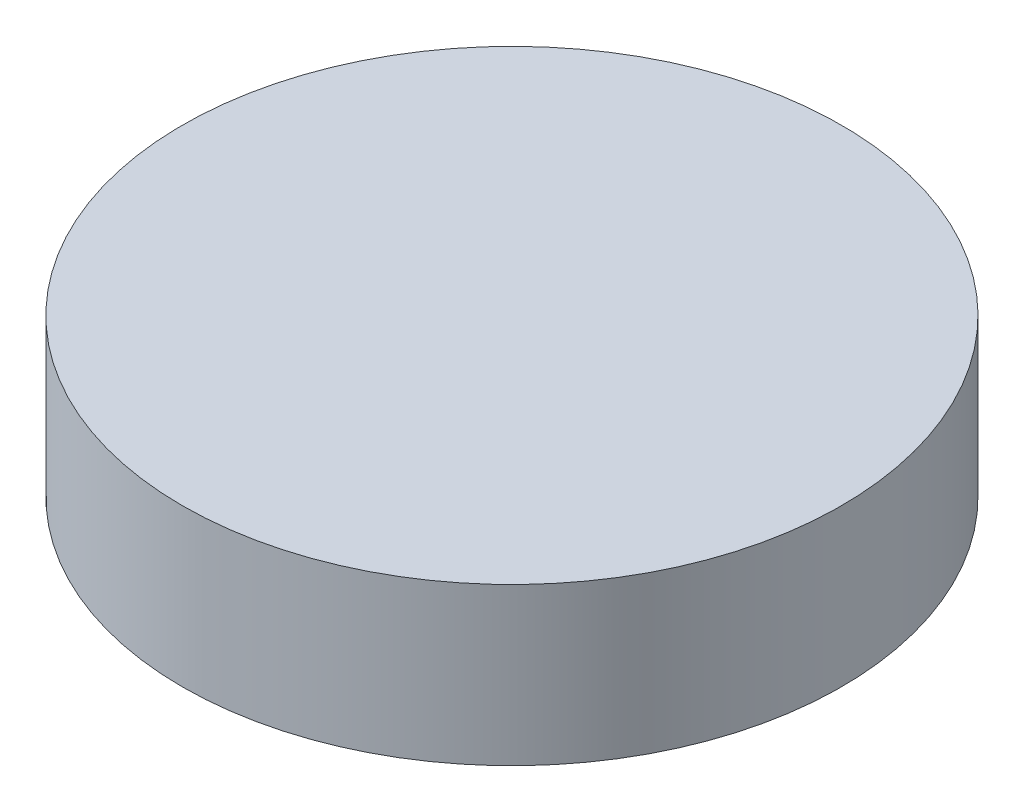
from build123d import *

# Parameters (mm, degrees)
SKETCH_1_R      = 10.5
EXTRUDE_1_DEPTH = 5


with BuildPart() as part:
    # 草圖1 → 填料-伸長1 (new body)
    with BuildSketch(Plane(origin=(0, 0, 0), x_dir=(1, 0, 0), z_dir=(0, 1, 0))):
        Circle(SKETCH_1_R)
    extrude(amount=EXTRUDE_1_DEPTH)


solid = part.part
